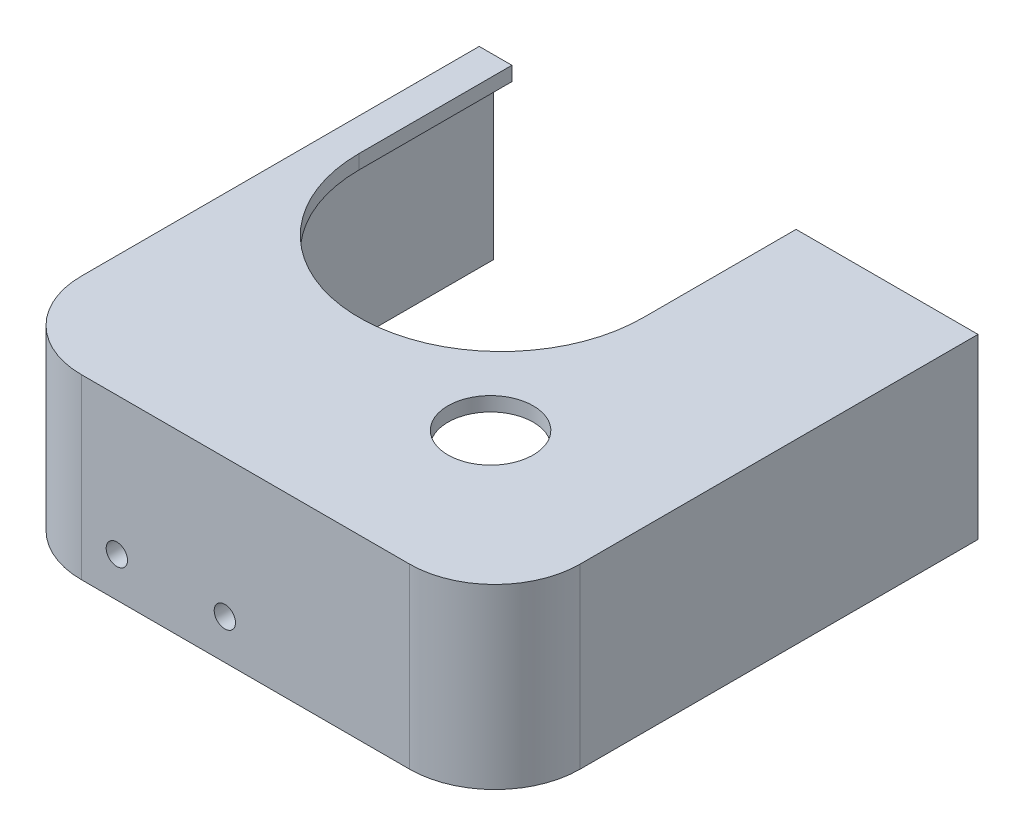
from build123d import *

# Parameters (mm, degrees)
SKETCH1_W             = 4.399513203
SKETCH1_H             = 6
SKETCH1_R             = 0.75
BOSS_EXTRUDE1_DEPTH   = 1.5
BOSS_EXTRUDE1_2_DEPTH = 1.5
BOSS_EXTRUDE2_START   = -1
SKETCH2_W             = 34.1
SKETCH2_H             = 12.5
SKETCH2_R             = 0.75
BOSS_EXTRUDE2_DEPTH   = 1
BOSS_EXTRUDE3_DEPTH   = 1
SKETCH5_W             = 34
SKETCH5_H             = 12.5
BOSS_EXTRUDE4_DEPTH   = 1
SKETCH6_W             = 34
SKETCH6_H             = 12.5
BOSS_EXTRUDE5_DEPTH   = 1
SKETCH7_W             = 3.200973594
SKETCH7_H             = 6
BOSS_EXTRUDE6_DEPTH   = 2
FILLET1_R             = 2
FILLET2_R             = 5
FILLET3_R             = 6
FILLET4_R             = 5
FILLET5_R             = 6
SKETCH8_R             = 3
CUT_EXTRUDE1_DEPTH    = 2
FILLET1_OF_MIRROR1_R  = 2
FILLET2_OF_MIRROR1_R  = 5
FILLET3_OF_MIRROR1_R  = 6
FILLET4_OF_MIRROR1_R  = 5
FILLET5_OF_MIRROR1_R  = 6
CUT_EXTRUDE2_START    = -10.5
CUT_EXTRUDE2_DEPTH    = 10.5
CUT_EXTRUDE4_START    = -1
CUT_EXTRUDE4_DEPTH    = 1


with BuildPart() as part:
    # Sketch1 → Boss-Extrude1 (new body)
    with BuildSketch(Plane.XY):
        with Locations((-7.699756602, -5)):
            Rectangle(SKETCH1_W, SKETCH1_H)
        with Locations((-7.7, -4.8)):
            Circle(SKETCH1_R, mode=Mode.SUBTRACT)
    boss_extrude1 = extrude(amount=BOSS_EXTRUDE1_DEPTH)



with BuildPart() as body_2:
    # Sketch1 → Boss-Extrude1 2 (new body)
    with BuildSketch(Plane.XY):
        with Locations((-15.300243399, -5)):
            Rectangle(SKETCH1_W, SKETCH1_H)
        with Locations((-15.3, -4.8)):
            Circle(SKETCH1_R, mode=Mode.SUBTRACT)
    boss_extrude1_2 = extrude(amount=BOSS_EXTRUDE1_2_DEPTH)


with BuildPart() as part_1:
    add(part.part)

    add(body_2.part)  # Boss-Extrude2 merges body 2
    # Sketch2 → Boss-Extrude2 (add)
    with BuildSketch(Plane.XY.offset(1.5).offset(BOSS_EXTRUDE2_START)):
        with Locations((-5.75, -8.25)):
            Rectangle(SKETCH2_W, SKETCH2_H)
        with Locations((-7.7, -4.8)):
            Circle(SKETCH2_R, mode=Mode.SUBTRACT)
        with Locations((-15.3, -4.8)):
            Circle(SKETCH2_R, mode=Mode.SUBTRACT)
    boss_extrude2 = extrude(amount=BOSS_EXTRUDE2_DEPTH)

    # Sketch4 → Boss-Extrude3 (add)
    with BuildSketch(Plane.XZ.offset(14.5)):
        with BuildLine():
            Line((-22.8, 0.5), (-22.8, -32.5))
            Line((-22.8, -32.5), (-21.5, -32.5))
            Line((-21.5, -32.5), (-21.5, -21.75))
            ThreePointArc((-21.5, -21.75), (-11.5, -11.75), (-1.5, -21.75))
            Line((-1.5, -21.75), (-1.5, -32.5))
            Line((-1.5, -32.5), (11.3, -32.5))
            Line((11.3, -32.5), (11.3, 0.5))
            Line((11.3, 0.5), (-22.8, 0.5))
        make_face()
    boss_extrude3 = extrude(amount=-BOSS_EXTRUDE3_DEPTH)

    # Sketch5 → Boss-Extrude4 (add)
    with BuildSketch(Plane.ZY.offset(22.8)):
        with Locations((-15.5, -8.25)):
            Rectangle(SKETCH5_W, SKETCH5_H)
    boss_extrude4 = extrude(amount=BOSS_EXTRUDE4_DEPTH)

    # Sketch6 → Boss-Extrude5 (add)
    with BuildSketch(Plane(origin=(11.3, 0, 0), x_dir=(0, 0, -1), z_dir=(1, 0, 0))):
        with Locations((15.5, -8.25)):
            Rectangle(SKETCH6_W, SKETCH6_H)
    boss_extrude5 = extrude(amount=-BOSS_EXTRUDE5_DEPTH)

    # Sketch7 → Boss-Extrude6 (add)
    with BuildSketch(Plane(origin=(0, 0, 0.5), x_dir=(-1, 0, 0), z_dir=(0, 0, -1))):
        with Locations((11.5, -5)):
            Rectangle(SKETCH7_W, SKETCH7_H)
    boss_extrude6 = extrude(amount=BOSS_EXTRUDE6_DEPTH)

    # Fillet1
    # the kernel refuses this fillet: 2 mm, written as the material it adds along each edge
    with BuildSketch(Plane(origin=(-17.5, -8, 0.5), x_dir=(0, 0, -1), z_dir=(1, 0, 0))) as fillet1_piece_1_section:
        with BuildLine():
            CenterArc((FILLET1_R, -FILLET1_R), FILLET1_R, 90, 90)
            Line((0, -FILLET1_R), (0, 0))
            Line((0, 0), (FILLET1_R, 0))
        make_face()
    fillet1_piece_1 = extrude(amount=12, mode=Mode.PRIVATE)
    fillet1_piece_1 = split(fillet1_piece_1, bisect_by=Plane(origin=(-15.300243398, -8.620266002, 0), z_dir=(0, 0, 1)), keep=Keep.TOP, mode=Mode.PRIVATE)
    fillet1_piece_1 = split(fillet1_piece_1, bisect_by=Plane(origin=(-13.100486797, -8.620266002, 0.317331321), z_dir=(-1, 0, 0)), keep=Keep.TOP, mode=Mode.PRIVATE)
    add(fillet1_piece_1)
    with BuildSketch(Plane(origin=(-17.5, -8, 0.5), x_dir=(0, 0, -1), z_dir=(1, 0, 0))) as fillet1_piece_2_section:
        with BuildLine():
            CenterArc((FILLET1_R, -FILLET1_R), FILLET1_R, 90, 90)
            Line((0, -FILLET1_R), (0, 0))
            Line((0, 0), (FILLET1_R, 0))
        make_face()
    fillet1_piece_2 = extrude(amount=12, mode=Mode.PRIVATE)
    fillet1_piece_2 = split(fillet1_piece_2, bisect_by=Plane(origin=(-9.899513203, -8.160707913, -0.423889575), z_dir=(-1, 0, 0)), keep=Keep.TOP, mode=Mode.PRIVATE)
    fillet1_piece_2 = split(fillet1_piece_2, bisect_by=Plane(origin=(-11.5, -8.160707913, 0), z_dir=(0, 0, -1)), keep=Keep.TOP, mode=Mode.PRIVATE)
    fillet1_piece_2 = split(fillet1_piece_2, bisect_by=Plane(origin=(-13.100486797, -8.160707913, -0.423889575), z_dir=(1, 0, 0)), keep=Keep.TOP, mode=Mode.PRIVATE)
    add(fillet1_piece_2)
    with BuildSketch(Plane(origin=(-17.5, -8, 0.5), x_dir=(0, 0, -1), z_dir=(1, 0, 0))) as fillet1_piece_3_section:
        with BuildLine():
            CenterArc((FILLET1_R, -FILLET1_R), FILLET1_R, 90, 90)
            Line((0, -FILLET1_R), (0, 0))
            Line((0, 0), (FILLET1_R, 0))
        make_face()
    fillet1_piece_3 = extrude(amount=12, mode=Mode.PRIVATE)
    fillet1_piece_3 = split(fillet1_piece_3, bisect_by=Plane(origin=(-9.899513203, -8.620266002, 0.317331321), z_dir=(-1, 0, 0)), keep=Keep.TOP, mode=Mode.PRIVATE)
    fillet1_piece_3 = split(fillet1_piece_3, bisect_by=Plane(origin=(-11.5, -8.620266002, 0), z_dir=(0, 0, 1)), keep=Keep.TOP, mode=Mode.PRIVATE)
    fillet1_piece_3 = split(fillet1_piece_3, bisect_by=Plane(origin=(-13.100486797, -8.620266002, 0.317331321), z_dir=(1, 0, 0)), keep=Keep.TOP, mode=Mode.PRIVATE)
    add(fillet1_piece_3)
    with BuildSketch(Plane(origin=(-17.5, -8, 0.5), x_dir=(0, 0, -1), z_dir=(1, 0, 0))) as fillet1_piece_4_section:
        with BuildLine():
            CenterArc((FILLET1_R, -FILLET1_R), FILLET1_R, 90, 90)
            Line((0, -FILLET1_R), (0, 0))
            Line((0, 0), (FILLET1_R, 0))
        make_face()
    fillet1_piece_4 = extrude(amount=12, mode=Mode.PRIVATE)
    fillet1_piece_4 = split(fillet1_piece_4, bisect_by=Plane(origin=(-9.899513203, -8.620266002, 0.317331321), z_dir=(1, 0, 0)), keep=Keep.TOP, mode=Mode.PRIVATE)
    fillet1_piece_4 = split(fillet1_piece_4, bisect_by=Plane(origin=(-7.699756602, -8.620266002, 0), z_dir=(0, 0, 1)), keep=Keep.TOP, mode=Mode.PRIVATE)
    add(fillet1_piece_4)

    # Fillet2
    fillet2_edges = [part_1.edges().sort_by_distance(p)[0] for p in [
        (-22.8, -7.75, 0.5),
    ]]
    fillet(fillet2_edges, radius=FILLET2_R)

    # Fillet3
    fillet3_edges = [part_1.edges().sort_by_distance(p)[0] for p in [
        (-23.8, -8.25, 1.5),
    ]]
    fillet(fillet3_edges, radius=FILLET3_R)

    # Fillet4
    fillet4_edges = [part_1.edges().sort_by_distance(p)[0] for p in [
        (10.3, -7.75, 0.5),
    ]]
    fillet(fillet4_edges, radius=FILLET4_R)

    # Fillet5
    fillet5_edges = [part_1.edges().sort_by_distance(p)[0] for p in [
        (11.3, -8.25, 1.5),
    ]]
    fillet(fillet5_edges, radius=FILLET5_R)

    # Sketch8 → Cut-Extrude1 (cut)
    with BuildSketch(Plane(origin=(0, -13.5, 0), x_dir=(1, 0, 0), z_dir=(0, 1, 0))):
        with Locations(Location((0, 9.5, 0), (0, 0, 270))):
            Circle(SKETCH8_R)
    cut_extrude1 = extrude(amount=-CUT_EXTRUDE1_DEPTH, mode=Mode.SUBTRACT)

    # Mirror1: Boss-Extrude1, Boss-Extrude1 2, Boss-Extrude2, Boss-Extrude3, Boss-Extrude4, Boss-Extrude5, Boss-Extrude6, Cut-Extrude1 across plane
    add(boss_extrude1.mirror(Plane(origin=(-11.5, -13.5, -21.75), x_dir=(0, 0, 1), z_dir=(0, -1, 0))))
    add(boss_extrude1_2.mirror(Plane(origin=(-11.5, -13.5, -21.75), x_dir=(0, 0, 1), z_dir=(0, -1, 0))))
    add(boss_extrude2.mirror(Plane(origin=(-11.5, -13.5, -21.75), x_dir=(0, 0, 1), z_dir=(0, -1, 0))))
    add(boss_extrude3.mirror(Plane(origin=(-11.5, -13.5, -21.75), x_dir=(0, 0, 1), z_dir=(0, -1, 0))))
    add(boss_extrude4.mirror(Plane(origin=(-11.5, -13.5, -21.75), x_dir=(0, 0, 1), z_dir=(0, -1, 0))))
    add(boss_extrude5.mirror(Plane(origin=(-11.5, -13.5, -21.75), x_dir=(0, 0, 1), z_dir=(0, -1, 0))))
    add(boss_extrude6.mirror(Plane(origin=(-11.5, -13.5, -21.75), x_dir=(0, 0, 1), z_dir=(0, -1, 0))))
    add(cut_extrude1.mirror(Plane(origin=(-11.5, -13.5, -21.75), x_dir=(0, 0, 1), z_dir=(0, -1, 0))), mode=Mode.SUBTRACT)

    # Fillet1 of Mirror1
    # the kernel refuses this fillet: 2 mm, written as the material it adds along each edge
    with BuildSketch(Plane(origin=(-5.5, -19, 0.5), x_dir=(0, 1, 0), z_dir=(-1, 0, 0))) as fillet1_of_mirror1_piece_1_section:
        with BuildLine():
            CenterArc((FILLET1_OF_MIRROR1_R, FILLET1_OF_MIRROR1_R), FILLET1_OF_MIRROR1_R, 180, 90)
            Line((0, FILLET1_OF_MIRROR1_R), (0, 0))
            Line((0, 0), (FILLET1_OF_MIRROR1_R, 0))
        make_face()
    fillet1_of_mirror1_piece_1 = extrude(amount=12, mode=Mode.PRIVATE)
    fillet1_of_mirror1_piece_1 = split(fillet1_of_mirror1_piece_1, bisect_by=Plane(origin=(-7.699756602, -18.379733998, 0), z_dir=(0, 0, 1)), keep=Keep.TOP, mode=Mode.PRIVATE)
    fillet1_of_mirror1_piece_1 = split(fillet1_of_mirror1_piece_1, bisect_by=Plane(origin=(-9.899513203, -18.379733998, 0.317331321), z_dir=(1, 0, 0)), keep=Keep.TOP, mode=Mode.PRIVATE)
    add(fillet1_of_mirror1_piece_1)
    with BuildSketch(Plane(origin=(-5.5, -19, 0.5), x_dir=(0, 1, 0), z_dir=(-1, 0, 0))) as fillet1_of_mirror1_piece_2_section:
        with BuildLine():
            CenterArc((FILLET1_OF_MIRROR1_R, FILLET1_OF_MIRROR1_R), FILLET1_OF_MIRROR1_R, 180, 90)
            Line((0, FILLET1_OF_MIRROR1_R), (0, 0))
            Line((0, 0), (FILLET1_OF_MIRROR1_R, 0))
        make_face()
    fillet1_of_mirror1_piece_2 = extrude(amount=12, mode=Mode.PRIVATE)
    fillet1_of_mirror1_piece_2 = split(fillet1_of_mirror1_piece_2, bisect_by=Plane(origin=(-11.5, -18.379733998, 0), z_dir=(0, 0, 1)), keep=Keep.TOP, mode=Mode.PRIVATE)
    fillet1_of_mirror1_piece_2 = split(fillet1_of_mirror1_piece_2, bisect_by=Plane(origin=(-13.100486797, -18.379733998, 0.317331321), z_dir=(1, 0, 0)), keep=Keep.TOP, mode=Mode.PRIVATE)
    fillet1_of_mirror1_piece_2 = split(fillet1_of_mirror1_piece_2, bisect_by=Plane(origin=(-9.899513203, -18.379733998, 0.317331321), z_dir=(-1, 0, 0)), keep=Keep.TOP, mode=Mode.PRIVATE)
    add(fillet1_of_mirror1_piece_2)
    with BuildSketch(Plane(origin=(-5.5, -19, 0.5), x_dir=(0, 1, 0), z_dir=(-1, 0, 0))) as fillet1_of_mirror1_piece_3_section:
        with BuildLine():
            CenterArc((FILLET1_OF_MIRROR1_R, FILLET1_OF_MIRROR1_R), FILLET1_OF_MIRROR1_R, 180, 90)
            Line((0, FILLET1_OF_MIRROR1_R), (0, 0))
            Line((0, 0), (FILLET1_OF_MIRROR1_R, 0))
        make_face()
    fillet1_of_mirror1_piece_3 = extrude(amount=12, mode=Mode.PRIVATE)
    fillet1_of_mirror1_piece_3 = split(fillet1_of_mirror1_piece_3, bisect_by=Plane(origin=(-11.5, -18.839292087, 0), z_dir=(0, 0, -1)), keep=Keep.TOP, mode=Mode.PRIVATE)
    fillet1_of_mirror1_piece_3 = split(fillet1_of_mirror1_piece_3, bisect_by=Plane(origin=(-13.100486797, -18.839292087, -0.423889575), z_dir=(1, 0, 0)), keep=Keep.TOP, mode=Mode.PRIVATE)
    fillet1_of_mirror1_piece_3 = split(fillet1_of_mirror1_piece_3, bisect_by=Plane(origin=(-9.899513203, -18.839292087, -0.423889575), z_dir=(-1, 0, 0)), keep=Keep.TOP, mode=Mode.PRIVATE)
    add(fillet1_of_mirror1_piece_3)
    with BuildSketch(Plane(origin=(-5.5, -19, 0.5), x_dir=(0, 1, 0), z_dir=(-1, 0, 0))) as fillet1_of_mirror1_piece_4_section:
        with BuildLine():
            CenterArc((FILLET1_OF_MIRROR1_R, FILLET1_OF_MIRROR1_R), FILLET1_OF_MIRROR1_R, 180, 90)
            Line((0, FILLET1_OF_MIRROR1_R), (0, 0))
            Line((0, 0), (FILLET1_OF_MIRROR1_R, 0))
        make_face()
    fillet1_of_mirror1_piece_4 = extrude(amount=12, mode=Mode.PRIVATE)
    fillet1_of_mirror1_piece_4 = split(fillet1_of_mirror1_piece_4, bisect_by=Plane(origin=(-15.300243398, -18.379733998, 0), z_dir=(0, 0, 1)), keep=Keep.TOP, mode=Mode.PRIVATE)
    fillet1_of_mirror1_piece_4 = split(fillet1_of_mirror1_piece_4, bisect_by=Plane(origin=(-13.100486797, -18.379733998, 0.317331321), z_dir=(-1, 0, 0)), keep=Keep.TOP, mode=Mode.PRIVATE)
    add(fillet1_of_mirror1_piece_4)

    # Fillet2 of Mirror1
    fillet2_of_mirror1_edges = [part_1.edges().sort_by_distance(p)[0] for p in [
        (-22.8, -19.25, 0.5),
    ]]
    fillet(fillet2_of_mirror1_edges, radius=FILLET2_OF_MIRROR1_R)

    # Fillet3 of Mirror1
    fillet3_of_mirror1_edges = [part_1.edges().sort_by_distance(p)[0] for p in [
        (-23.8, -18.75, 1.5),
    ]]
    fillet(fillet3_of_mirror1_edges, radius=FILLET3_OF_MIRROR1_R)

    # Fillet4 of Mirror1
    fillet4_of_mirror1_edges = [part_1.edges().sort_by_distance(p)[0] for p in [
        (10.3, -19.25, 0.5),
    ]]
    fillet(fillet4_of_mirror1_edges, radius=FILLET4_OF_MIRROR1_R)

    # Fillet5 of Mirror1
    fillet5_of_mirror1_edges = [part_1.edges().sort_by_distance(p)[0] for p in [
        (11.3, -18.75, 1.5),
    ]]
    fillet(fillet5_of_mirror1_edges, radius=FILLET5_OF_MIRROR1_R)

    # Sketch9 → Cut-Extrude2 (cut)
    with BuildSketch(Plane(origin=(0, -2, 0), x_dir=(1, 0, 0), z_dir=(0, 1, 0)).offset(CUT_EXTRUDE2_START)):
        with BuildLine():
            Line((-17.8, -1.5), (5.3, -1.5))
            ThreePointArc((5.3, -1.5), (9.542640687, 0.257359313), (11.3, 4.5))
            Line((11.3, 4.5), (11.3, 32.5))
            Line((11.3, 32.5), (10.3, 32.5))
            Line((10.3, 32.5), (10.3, 4.5))
            ThreePointArc((10.3, 4.5), (8.835533906, 0.964466094), (5.3, -0.5))
            Line((5.3, -0.5), (-5.5, -0.5))
            Line((-5.5, -0.5), (-5.5, 0))
            Line((-5.5, 0), (-9.899513203, 0))
            Line((-9.899513203, 0), (-9.899513203, 1.5))
            Line((-9.899513203, 1.5), (-13.100486797, 1.5))
            Line((-13.100486797, 1.5), (-13.100486797, 0))
            Line((-13.100486797, 0), (-17.5, 0))
            Line((-17.5, 0), (-17.5, -0.5))
            Line((-17.5, -0.5), (-17.8, -0.5))
            ThreePointArc((-17.8, -0.5), (-21.335533906, 0.964466094), (-22.8, 4.5))
            Line((-22.8, 4.5), (-22.8, 32.5))
            Line((-22.8, 32.5), (-23.8, 32.5))
            Line((-23.8, 32.5), (-23.8, 4.5))
            ThreePointArc((-23.8, 4.5), (-22.042640687, 0.257359313), (-17.8, -1.5))
        make_face()
    extrude(amount=CUT_EXTRUDE2_DEPTH, mode=Mode.SUBTRACT)

    # Sketch12 → Cut-Extrude4 (cut)
    with BuildSketch(Plane.XZ.offset(14.5).offset(CUT_EXTRUDE4_START)):
        with BuildLine():
            Line((-22.8, -4.5), (-22.8, -32.5))
            Line((-22.8, -32.5), (-21.5, -32.5))
            Line((-21.5, -32.5), (-21.5, -21.75))
            ThreePointArc((-21.5, -21.75), (-11.5, -11.75), (-1.5, -21.75))
            Line((-1.5, -21.75), (-1.5, -32.5))
            Line((-1.5, -32.5), (10.3, -32.5))
            Line((10.3, -32.5), (10.3, -4.5))
            ThreePointArc((10.3, -4.5), (8.835533906, -0.964466094), (5.3, 0.5))
            Line((5.3, 0.5), (-17.8, 0.5))
            ThreePointArc((-17.8, 0.5), (-21.335533906, -0.964466094), (-22.8, -4.5))
        make_face()
    extrude(amount=CUT_EXTRUDE4_DEPTH, mode=Mode.SUBTRACT)


solid = part_1.part
